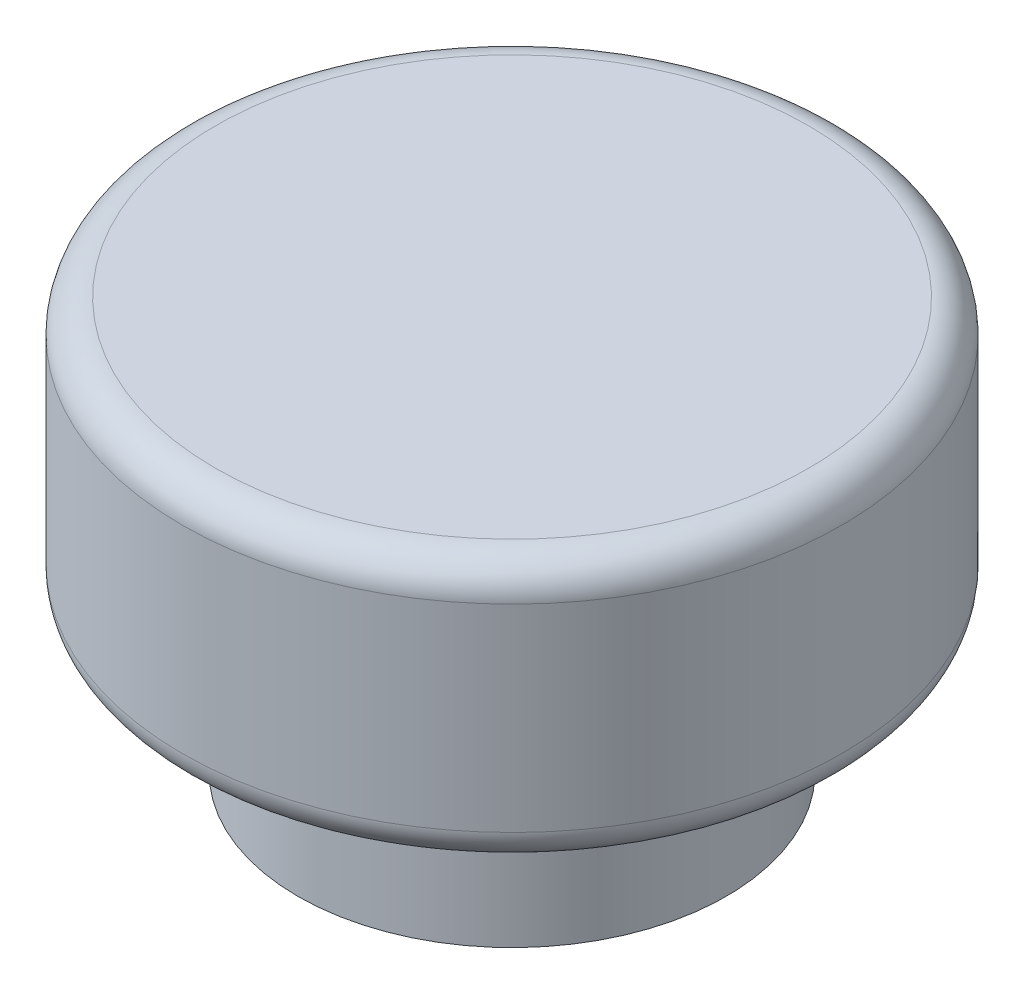
from build123d import *
from OCP.BRepFilletAPI import BRepFilletAPI_MakeChamfer

# Parameters (mm, degrees)
BOSS_EXTRUDE1_DEPTH  = 1.75
BOSS_EXTRUDE2_DEPTH  = 0.5
BOSS_EXTRUDE5_DEPTH  = 3.5
SKETCH4_R            = 3.5
BOSS_EXTRUDE7_DEPTH  = 2
SKETCH11_R           = 4.505443821
SKETCH11_R_2         = 3.5
CUT_EXTRUDE3_DEPTH   = 2
SKETCH12_R           = 3.5
CUT_EXTRUDE4_DEPTH   = 3
BOSS_EXTRUDE8_DEPTH  = 2.5
CHAMFER1_SIZE        = 0.5
CHAMFER1_SIZE2       = 0.288675135
SKETCH17_R           = 3.25
BOSS_EXTRUDE9_DEPTH  = 3
SKETCH18_R           = 1.768100224
CUT_EXTRUDE8_DEPTH   = 2.25
SKETCH20_R           = 5
BOSS_EXTRUDE10_DEPTH = 2
BOSS_EXTRUDE11_START = 2
SKETCH21_R           = 5
BOSS_EXTRUDE11_DEPTH = 2
FILLET1_R            = 0.5
FILLET2_R            = 0.5


with BuildPart() as part:
    # Sketch1 → Boss-Extrude1 (new body)
    with BuildSketch(Plane(origin=(0, 0, 0), x_dir=(1, 0, 0), z_dir=(0, 1, 0))):
        Polygon((0.658179307, 0), (0.329089653, 0.57), (-0.329089653, 0.57), (-0.658179307, 0), (-0.329089653, -0.57), (0.329089653, -0.57), align=None)
    extrude(amount=BOSS_EXTRUDE1_DEPTH)

    # Sketch2 → Boss-Extrude2 (add)
    with BuildSketch(Plane(origin=(0, 1.75, 0), x_dir=(1, 0, 0), z_dir=(0, 1, 0))):
        Polygon((0, 0.197762982), (0, -0.198641554), (4.375, 0), align=None)
    extrude(amount=BOSS_EXTRUDE2_DEPTH)

    # Sketch3 → Boss-Extrude5 (add)
    with BuildSketch(Plane(origin=(0, 1.75, 0), x_dir=(1, 0, 0), z_dir=(0, 1, 0))):
        Polygon((0.658179307, 0), (0.329089653, 0.57), (-0.329089653, 0.57), (-0.658179307, 0), (-0.329089653, -0.57), (0.329089653, -0.57), align=None)
    extrude(amount=BOSS_EXTRUDE5_DEPTH)

    # Sketch4 → Boss-Extrude7 (add)
    with BuildSketch(Plane(origin=(0, 5.25, 0), x_dir=(1, 0, 0), z_dir=(0, 1, 0))):
        Circle(SKETCH4_R)
    extrude(amount=BOSS_EXTRUDE7_DEPTH)

    # Sketch11 → Cut-Extrude3 (cut)
    with BuildSketch(Plane(origin=(0, 1.75, 0), x_dir=(-1, 0, 0), z_dir=(0, -1, 0))):
        Circle(SKETCH11_R)
        Circle(SKETCH11_R_2, mode=Mode.SUBTRACT)
    extrude(amount=-CUT_EXTRUDE3_DEPTH, mode=Mode.SUBTRACT)

    # Sketch12 → Cut-Extrude4 (cut)
    with BuildSketch(Plane(origin=(0, 0, 0), x_dir=(-1, 0, 0), z_dir=(0, -1, 0))):
        Circle(SKETCH12_R)
    extrude(amount=-CUT_EXTRUDE4_DEPTH, mode=Mode.SUBTRACT)

    # Sketch16 → Boss-Extrude8 (add)
    with BuildSketch(Plane(origin=(0, 3, 0), x_dir=(-1, 0, 0), z_dir=(0, -1, 0))):
        Polygon((0.55, -0.952627944), (1.1, 0), (0.55, 0.952627944), (-0.55, 0.952627944), (-1.1, 0), (-0.55, -0.952627944), align=None)
    extrude(amount=-BOSS_EXTRUDE8_DEPTH)

    # Chamfer1: one chamfer whose edges measure the first distance from different faces: ONE call of the kernel's chamfer builder (chamfer() names one face for all edges)
    chamfer1_edges_1 = [part.edges().sort_by_distance(p)[0] for p in [
        (0, 5.25, 0.952627944),
    ]]
    chamfer1_side_1 = [part.faces().sort_by_distance(p)[0] for p in [
        (0, 4.125, 0.952627944),
    ]]
    chamfer1_edges_2 = [part.edges().sort_by_distance(p)[0] for p in [
        (-0.825, 5.25, 0.476313972),
    ]]
    chamfer1_side_2 = [part.faces().sort_by_distance(p)[0] for p in [
        (-0.825, 4.125, 0.476313972),
    ]]
    chamfer1_edges_3 = [part.edges().sort_by_distance(p)[0] for p in [
        (-0.825, 5.25, -0.476313972),
    ]]
    chamfer1_side_3 = [part.faces().sort_by_distance(p)[0] for p in [
        (-0.825, 4.125, -0.476313972),
    ]]
    chamfer1_edges_4 = [part.edges().sort_by_distance(p)[0] for p in [
        (0, 5.25, -0.952627944),
    ]]
    chamfer1_side_4 = [part.faces().sort_by_distance(p)[0] for p in [
        (0, 4.125, -0.952627944),
    ]]
    chamfer1_edges_5 = [part.edges().sort_by_distance(p)[0] for p in [
        (0.825, 5.25, -0.476313972),
    ]]
    chamfer1_side_5 = [part.faces().sort_by_distance(p)[0] for p in [
        (0.825, 4.125, -0.476313972),
    ]]
    chamfer1_edges_6 = [part.edges().sort_by_distance(p)[0] for p in [
        (0.825, 5.25, 0.476313972),
    ]]
    chamfer1_side_6 = [part.faces().sort_by_distance(p)[0] for p in [
        (0.825, 4.125, 0.476313972),
    ]]
    chamfer1 = BRepFilletAPI_MakeChamfer(part.part.solid().wrapped)
    for e in chamfer1_edges_1:
        chamfer1.Add(CHAMFER1_SIZE, CHAMFER1_SIZE2, e.wrapped, chamfer1_side_1[0].wrapped)  # the first distance lies on this face
    for e in chamfer1_edges_2:
        chamfer1.Add(CHAMFER1_SIZE, CHAMFER1_SIZE2, e.wrapped, chamfer1_side_2[0].wrapped)  # the first distance lies on this face
    for e in chamfer1_edges_3:
        chamfer1.Add(CHAMFER1_SIZE, CHAMFER1_SIZE2, e.wrapped, chamfer1_side_3[0].wrapped)  # the first distance lies on this face
    for e in chamfer1_edges_4:
        chamfer1.Add(CHAMFER1_SIZE, CHAMFER1_SIZE2, e.wrapped, chamfer1_side_4[0].wrapped)  # the first distance lies on this face
    for e in chamfer1_edges_5:
        chamfer1.Add(CHAMFER1_SIZE, CHAMFER1_SIZE2, e.wrapped, chamfer1_side_5[0].wrapped)  # the first distance lies on this face
    for e in chamfer1_edges_6:
        chamfer1.Add(CHAMFER1_SIZE, CHAMFER1_SIZE2, e.wrapped, chamfer1_side_6[0].wrapped)  # the first distance lies on this face
    add(Compound.cast(chamfer1.Shape()), mode=Mode.REPLACE)

    # Sketch17 → Boss-Extrude9 (add)
    with BuildSketch(Plane(origin=(0, 3, 0), x_dir=(-1, 0, 0), z_dir=(0, -1, 0))):
        Circle(SKETCH17_R)
        Polygon((-2.995914926, 0), (-1.497957463, -2.594538434), (1.497957463, -2.594538434), (2.995914926, 0), (1.497957463, 2.594538434), (-1.497957463, 2.594538434), align=None, mode=Mode.SUBTRACT)
    extrude(amount=-BOSS_EXTRUDE9_DEPTH)

    # Sketch18 → Cut-Extrude8 (cut)
    with BuildSketch(Plane(origin=(0, 3, 0), x_dir=(-1, 0, 0), z_dir=(0, -1, 0))):
        Circle(SKETCH18_R)
    extrude(amount=-CUT_EXTRUDE8_DEPTH, mode=Mode.SUBTRACT)

    # Sketch20 → Boss-Extrude10 (add)
    with BuildSketch(Plane(origin=(0, 7.25, 0), x_dir=(1, 0, 0), z_dir=(0, 1, 0))):
        Circle(SKETCH20_R)
    extrude(amount=-BOSS_EXTRUDE10_DEPTH)

    # Sketch21 → Boss-Extrude11 (add)
    with BuildSketch(Plane(origin=(0, 7.25, 0), x_dir=(1, 0, 0), z_dir=(0, 1, 0)).offset(BOSS_EXTRUDE11_START)):
        Circle(SKETCH21_R)
    extrude(amount=-BOSS_EXTRUDE11_DEPTH)

    # Fillet1
    fillet1_edges = [part.edges().sort_by_distance(p)[0] for p in [
        (-5, 5.25, 0),
        (-5, 9.25, 0),
    ]]
    fillet(fillet1_edges, radius=FILLET1_R)

    # Fillet2
    fillet2_edges = [part.edges().sort_by_distance(p)[0] for p in [
        (3.25, 5.25, 0),
    ]]
    fillet(fillet2_edges, radius=FILLET2_R)


solid = part.part
